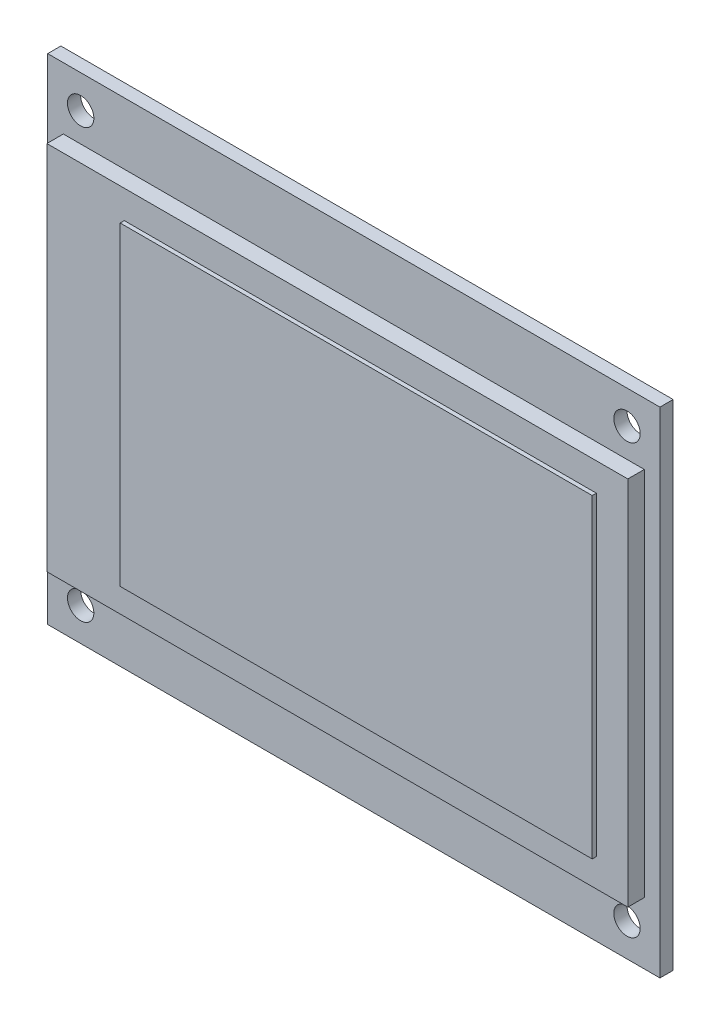
from build123d import *

# Parameters (mm, degrees)
SKETCH1_W                      = 74.3
SKETCH1_H                      = 60
BOSS_EXTRUDE1_DEPTH            = 1.6
SKETCH2_W                      = 1.9
SKETCH2_H                      = 15
CUT_EXTRUDE1_DEPTH             = 96.514658561
F_3_2_3_2_DIAMETER_HOLE1_D     = 3.2
F_3_2_3_2_DIAMETER_HOLE1_DEPTH = 60
F_3_2_3_2_DIAMETER_HOLE1_TIP   = 0.96137699
SKETCH6_W                      = 70.5
SKETCH6_H                      = 45
BOSS_EXTRUDE2_DEPTH            = 2
SKETCH7_W                      = 57.288
SKETCH7_H                      = 38.192
BOSS_EXTRUDE3_DEPTH            = 0.5


with BuildPart() as part:
    # Sketch1 → Boss-Extrude1 (new body)
    with BuildSketch(Plane.XY):
        with Locations((37.15, 30)):
            Rectangle(SKETCH1_W, SKETCH1_H)
    extrude(amount=BOSS_EXTRUDE1_DEPTH)

    # Sketch2 → Cut-Extrude1 (cut, through all)
    with BuildSketch(Plane.XY.offset(1.6)):
        with Locations((0.95, 15)):
            Rectangle(SKETCH2_W, SKETCH2_H)
    extrude(amount=-CUT_EXTRUDE1_DEPTH, mode=Mode.SUBTRACT)

    # Ø3.2 (3.2) Diameter Hole1
    with Locations(Plane.XY.offset(1.6)):
        with Locations((4, 56), (70.3, 56), (70.3, 4), (4, 4)):
            Hole(F_3_2_3_2_DIAMETER_HOLE1_D / 2, depth=F_3_2_3_2_DIAMETER_HOLE1_DEPTH)
            with Locations((0, 0, -(F_3_2_3_2_DIAMETER_HOLE1_DEPTH + F_3_2_3_2_DIAMETER_HOLE1_TIP / 2))):  # 118° drill point
                Cone(0, F_3_2_3_2_DIAMETER_HOLE1_D / 2, F_3_2_3_2_DIAMETER_HOLE1_TIP, mode=Mode.SUBTRACT)

    # Sketch6 → Boss-Extrude2 (add)
    with BuildSketch(Plane.XY.offset(1.6)):
        with Locations((37.15, 30)):
            Rectangle(SKETCH6_W, SKETCH6_H)
    extrude(amount=BOSS_EXTRUDE2_DEPTH)

    # Sketch7 → Boss-Extrude3 (add)
    with BuildSketch(Plane.XY.offset(3.6)):
        with Locations((39.936, 30)):
            Rectangle(SKETCH7_W, SKETCH7_H)
    extrude(amount=BOSS_EXTRUDE3_DEPTH)


solid = part.part
